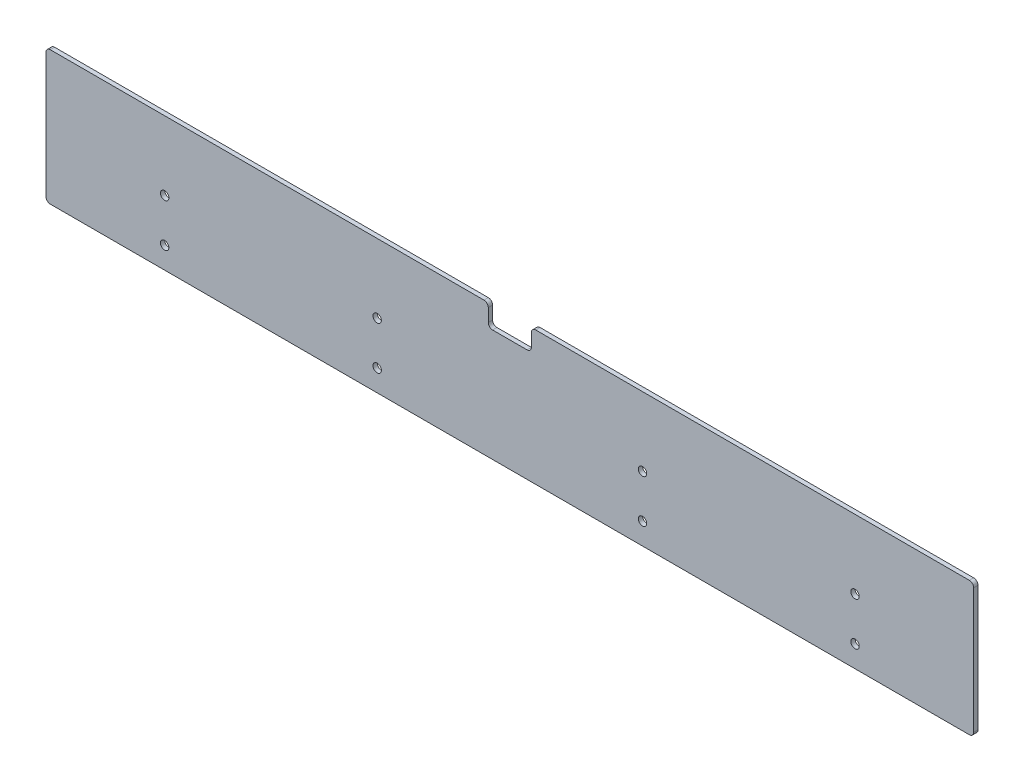
from build123d import *

# Parameters (mm, degrees)
SKETCH1_R           = 1.95
BOSS_EXTRUDE1_DEPTH = 2
FILLET1_R           = 2
SKETCH2_R           = 1.95
CUT_EXTRUDE1_DEPTH  = 10


with BuildPart() as part:
    # Sketch1 → Boss-Extrude1 (new body)
    with BuildSketch(Plane.XY):
        Polygon((-131.905896291, 17.703517588), (73.094103709, 17.703517588), (73.094103709, -44.296482412), (-356.905896291, -44.296482412), (-356.905896291, 17.703517588), (-151.905896291, 17.703517588), (-151.905896291, 7.703517588), (-131.905896291, 7.703517588), align=None)
        with Locations((-80.405896291, -14.296482412)):
            Circle(SKETCH1_R, mode=Mode.SUBTRACT)
        with Locations((-80.405896291, -34.296482412)):
            Circle(SKETCH1_R, mode=Mode.SUBTRACT)
        with Locations((-203.405896291, -14.296482412)):
            Circle(SKETCH1_R, mode=Mode.SUBTRACT)
        with Locations((-203.405896291, -34.296482412)):
            Circle(SKETCH1_R, mode=Mode.SUBTRACT)
    extrude(amount=BOSS_EXTRUDE1_DEPTH)

    # Fillet1
    fillet1_edges = [part.edges().sort_by_distance(p)[0] for p in [
        (73.094103709, -44.296482412, 1),
        (-356.905896291, -44.296482412, 1),
        (-356.905896291, 17.703517588, 1),
        (-151.905896291, 7.703517588, 1),
        (-151.905896291, 17.703517588, 1),
        (-131.905896291, 7.703517588, 1),
        (-131.905896291, 17.703517588, 1),
        (73.094103709, 17.703517588, 1),
    ]]
    fillet(fillet1_edges, radius=FILLET1_R)

    # Sketch2 → Cut-Extrude1 (cut)
    with BuildSketch(Plane.XY.offset(2)):
        with Locations((-301.905896291, -14.296482412)):
            Circle(SKETCH2_R)
        with Locations((-301.905896291, -34.296482412)):
            Circle(SKETCH2_R)
        with Locations((18.094103709, -14.296482412)):
            Circle(SKETCH2_R)
        with Locations((18.094103709, -34.296482412)):
            Circle(SKETCH2_R)
    extrude(amount=-CUT_EXTRUDE1_DEPTH, mode=Mode.SUBTRACT)


solid = part.part
